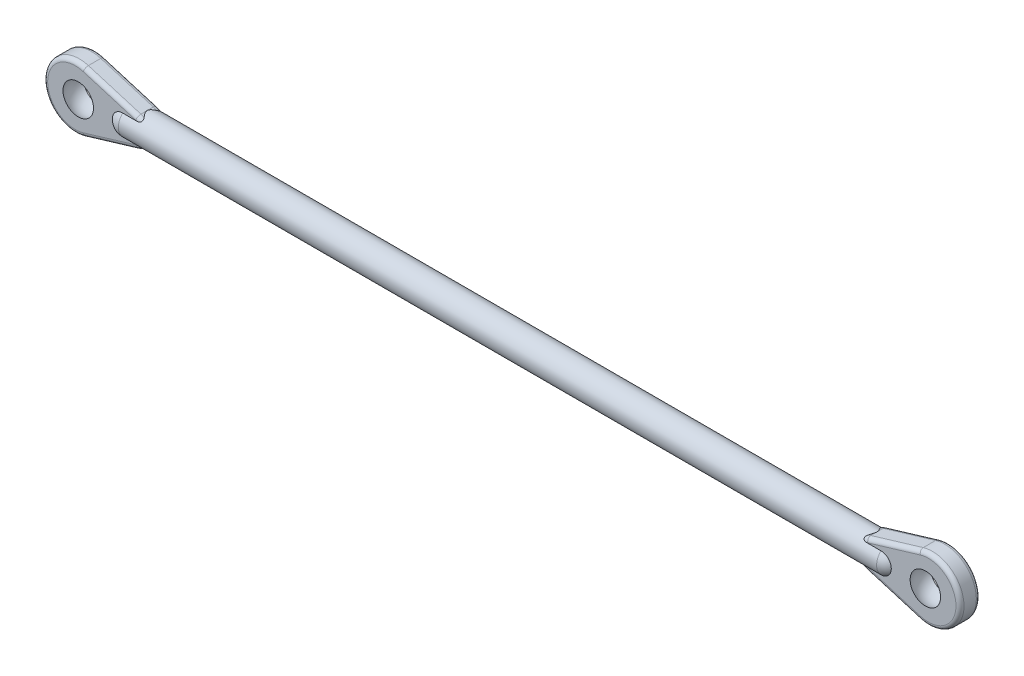
from build123d import *

# Parameters (mm, degrees)
SKETCH1_R           = 2.4257
BOSS_EXTRUDE1_DEPTH = 65.7225
FILLET1_R           = 2.4257
BOSS_EXTRUDE2_DEPTH = 1.7018
FILLET2_R           = 0.6731


with BuildPart() as part:
    # Sketch1 → Boss-Extrude1 (new, symmetric)
    with BuildSketch(Plane(origin=(0, 0, 0), x_dir=(0, 0, -1), z_dir=(1, 0, 0))):
        Circle(SKETCH1_R)
    extrude(amount=BOSS_EXTRUDE1_DEPTH, both=True)

    # Fillet1
    fillet1_edges = [part.edges().sort_by_distance(p)[0] for p in [
        (-65.7225, 0, 2.4257),
        (65.7225, 0, 2.4257),
    ]]
    fillet(fillet1_edges, radius=FILLET1_R)

    # Sketch2 → Boss-Extrude2 (add, symmetric)
    with BuildSketch(Plane.XY):
        with BuildLine():
            Line((69.688654018, 5.059748452), (60.9219, 2.4257))
            ThreePointArc((60.9219, 2.4257), (59.117897756, 0), (60.9219, -2.4257))
            Line((60.9219, -2.4257), (69.688654018, -5.059748452))
            ThreePointArc((69.688654018, -5.059748452), (76.4921, 0), (69.688654018, 5.059748452))
        make_face()
        with BuildLine():
            Line((-69.688654018, -5.059748452), (-60.9219, -2.4257))
            ThreePointArc((-60.9219, -2.4257), (-59.117897756, 0), (-60.9219, 2.4257))
            Line((-60.9219, 2.4257), (-69.688654018, 5.059748452))
            ThreePointArc((-69.688654018, 5.059748452), (-76.4921, 0), (-69.688654018, -5.059748452))
        make_face()
    extrude(amount=BOSS_EXTRUDE2_DEPTH, both=True)

    # Sketch2<4> → Cut-Revolve1 (revolve, cut)
    with BuildSketch(Plane.XY):
        with BuildLine():
            ThreePointArc((67.6529, 0), (70.7136, -3.0607), (73.7743, 0))
            Line((73.7743, 0), (67.6529, 0))
        make_face()
        with BuildLine():
            Line((-67.6529, 0), (-73.7743, 0))
            ThreePointArc((-73.7743, 0), (-70.7136, -3.0607), (-67.6529, 0))
        make_face()
    revolve(axis=Axis((73.7743, 0, 0), (-1, 0, 0)), mode=Mode.SUBTRACT)

    # Fillet2
    fillet2_edges = [part.edges().sort_by_distance(p)[0] for p in [
        (60.314399636, 2.151614141, -1.7018),
        (65.305277009, 3.742724226, -1.7018),
        (60.314399636, -2.151614141, -1.7018),
        (65.305277009, -3.742724226, -1.7018),
        (60.314399636, 2.151614141, 1.7018),
        (65.305277009, 3.742724226, 1.7018),
        (60.314399636, -2.151614141, 1.7018),
        (65.305277009, -3.742724226, 1.7018),
        (-60.314399636, 2.151614141, -1.7018),
        (-65.305277009, 3.742724226, -1.7018),
        (-60.314399636, -2.151614141, -1.7018),
        (-65.305277009, -3.742724226, -1.7018),
        (-60.314399636, 2.151614141, 1.7018),
        (-65.305277009, 3.742724226, 1.7018),
        (-60.314399636, -2.151614141, 1.7018),
        (-65.305277009, -3.742724226, 1.7018),
        (76.4921, 0, -1.7018),
        (76.4921, 0, 1.7018),
        (-76.4921, 0, -1.7018),
        (-76.4921, 0, 1.7018),
    ]]
    fillet(fillet2_edges, radius=FILLET2_R)


solid = part.part
